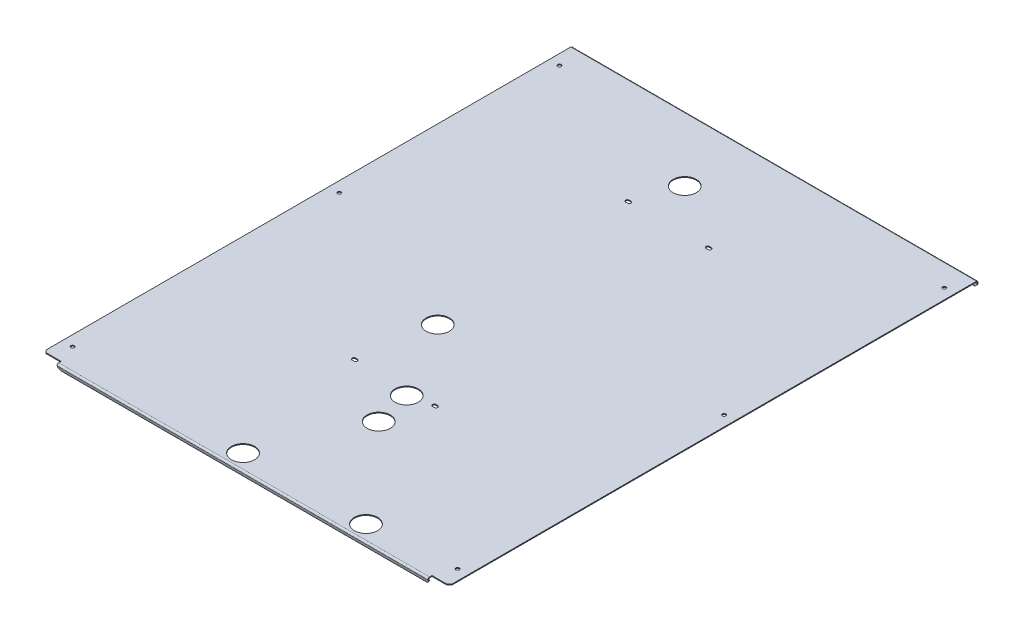
from build123d import *

# Parameters (mm, degrees)
SKETCH2_W               = 444.5
SKETCH2_H               = 584.2
BOSS_EXTRUDE1_DEPTH     = 6.35
MOVE_START              = -2.17182791
MOVE_FACE1_OUTLINE_W    = 448
MOVE_FACE1_OUTLINE_H    = 9
MOVE_FACE1_DEPTH        = 2.17182791
CONVERT_SOLID1_START    = -222.25
CONVERT_SOLID1_DEPTH    = 444.5
SKETCH7_W               = 19.05
SKETCH7_H               = 5.08
CUT_EXTRUDE1_DEPTH      = 626.080014878
SKETCH9_R               = 1.905
CUT_EXTRUDE2_DEPTH      = 1.2192
CHAMFER1_SIZE           = 2.54
CUT_EXTRUDE3_DEPTH      = 626.080014878
CUT_EXTRUDE3_DEPTH_BACK = 626.080014878
SKETCH10_R              = 12.7


# Read off the part's stored shape, not the designer's step: Move Face1, Convert-Solid1
with BuildPart() as part:
    # Sketch2 → Boss-Extrude1 (new body)
    with BuildSketch(Plane(origin=(0, 0, 0), x_dir=(1, 0, 0), z_dir=(0, 1, 0))):
        with Locations((0, 292.1)):
            Rectangle(SKETCH2_W, SKETCH2_H)
    extrude(amount=-BOSS_EXTRUDE1_DEPTH)

    # Move Face1 outline → Move Face1 (cut)
    with BuildSketch(Plane(origin=(0, 0, 0), x_dir=(1, 0, 0), z_dir=(0, 0.3420201433256691, -0.9396926207859083)).offset(MOVE_START)):
        with Locations((0, 3.5)):
            Rectangle(MOVE_FACE1_OUTLINE_W, MOVE_FACE1_OUTLINE_H)
    extrude(amount=MOVE_FACE1_DEPTH, mode=Mode.SUBTRACT)

    # Convert-Solid1 outline → Convert-Solid1 (cut)
    with BuildSketch(Plane.YZ.offset(CONVERT_SOLID1_START)):
        with BuildLine():
            Line((-6.037256781, -3.17046592), (-6.35, -2.311210988))
            Line((-6.35, -2.311210988), (-6.35, -583.2856))
            Line((-6.35, -583.2856), (-1.6764, -583.2856))
            ThreePointArc((-1.6764, -583.2856), (-1.137584633, -583.062415367), (-0.9144, -582.5236))
            Line((-0.9144, -582.5236), (-0.9144, -2.394147319))
            ThreePointArc((-0.9144, -2.394147319), (-1.239334756, -1.769953461), (-1.937019349, -1.678101541))
            Line((-1.937019349, -1.678101541), (-6.037256781, -3.17046592))
        make_face()
        with BuildLine():
            Line((0, 0), (-2.249762568, -0.818846609))
            ThreePointArc((-2.249762568, -0.818846609), (-0.714856462, -1.020920831), (0, -2.394147319))
            Line((0, -2.394147319), (0, 0))
        make_face()
        with BuildLine():
            Line((0, -584.2), (0, -582.5236))
            ThreePointArc((0, -582.5236), (-0.491006192, -583.708993808), (-1.6764, -584.2))
            Line((-1.6764, -584.2), (0, -584.2))
        make_face()
    extrude(amount=CONVERT_SOLID1_DEPTH, mode=Mode.SUBTRACT)

    # Sketch7 → Cut-Extrude1 (cut, through all)
    with BuildSketch(Plane(origin=(0, 0, 0), x_dir=(1, 0, 0), z_dir=(0, 1, 0))):
        with Locations((-212.725, 2.54)):
            Rectangle(SKETCH7_W, SKETCH7_H)
        with Locations((212.725, 2.54)):
            Rectangle(SKETCH7_W, SKETCH7_H)
    extrude(amount=-CUT_EXTRUDE1_DEPTH, mode=Mode.SUBTRACT)

    # Sketch9 → Cut-Extrude2 (cut)
    with BuildSketch(Plane(origin=(0, 0, 0), x_dir=(1, 0, 0), z_dir=(0, 1, 0))):
        with Locations(Location((-210.82, 25.4, 0), (0, 0, 270))):
            Circle(SKETCH9_R)
        with Locations(Location((-210.82, 317.5, 0), (0, 0, 270))):
            Circle(SKETCH9_R)
        with Locations(Location((-210.82, 558.8, 0), (0, 0, 270))):
            Circle(SKETCH9_R)
        with Locations(Location((210.82, 558.8, 0), (0, 0, 90))):
            Circle(SKETCH9_R)
        with Locations(Location((210.82, 317.5, 0), (0, 0, 90))):
            Circle(SKETCH9_R)
        with Locations(Location((210.82, 25.4, 0), (0, 0, 90))):
            Circle(SKETCH9_R)
        with BuildLine():
            Line((-43.0182, 465.455), (-45.0182, 465.455))
            ThreePointArc((-45.0182, 465.455), (-46.9232, 467.36), (-45.0182, 469.265))
            Line((-45.0182, 469.265), (-43.0182, 469.265))
            ThreePointArc((-43.0182, 469.265), (-41.1132, 467.36), (-43.0182, 465.455))
        make_face()
        with BuildLine():
            Line((45.0182, 465.455), (43.0182, 465.455))
            ThreePointArc((43.0182, 465.455), (41.1132, 467.36), (43.0182, 469.265))
            Line((43.0182, 469.265), (45.0182, 469.265))
            ThreePointArc((45.0182, 469.265), (46.9232, 467.36), (45.0182, 465.455))
        make_face()
        with BuildLine():
            Line((-43.0182, 165.735), (-45.0182, 165.735))
            ThreePointArc((-45.0182, 165.735), (-46.9232, 167.64), (-45.0182, 169.545))
            Line((-45.0182, 169.545), (-43.0182, 169.545))
            ThreePointArc((-43.0182, 169.545), (-41.1132, 167.64), (-43.0182, 165.735))
        make_face()
        with BuildLine():
            Line((45.0182, 165.735), (43.0182, 165.735))
            ThreePointArc((43.0182, 165.735), (41.1132, 167.64), (43.0182, 169.545))
            Line((43.0182, 169.545), (45.0182, 169.545))
            ThreePointArc((45.0182, 169.545), (46.9232, 167.64), (45.0182, 165.735))
        make_face()
    extrude(amount=-CUT_EXTRUDE2_DEPTH, mode=Mode.SUBTRACT)

    # Chamfer1
    chamfer1_edges = [part.edges().sort_by_distance(p)[0] for p in [
        (-222.25, -6.35, -583.7428),
        (222.25, -6.35, -583.7428),
        (-222.25, -0.4572, -5.08),
        (-203.2, -6.193628391, -2.740838454),
        (222.25, -0.4572, -5.08),
        (203.2, -6.193628391, -2.740838454),
    ]]
    chamfer(chamfer1_edges, length=CHAMFER1_SIZE)

    # Sketch10 → Cut-Extrude3 (cut, two sides: drawn at the far end of the back side and taken through both)
    with BuildSketch(Plane(origin=(0, 0, 0), x_dir=(1, 0, 0), z_dir=(0, 1, 0)).offset(-CUT_EXTRUDE3_DEPTH_BACK)):
        with Locations(Location((18.542, 162.007747319, 0), (0, 0, 270))):
            Circle(SKETCH10_R)
        with Locations(Location((-16.51, 17.78, 0), (0, 0, 270))):
            Circle(SKETCH10_R)
        with Locations(Location((-31.75, 246.38, 0), (0, 0, 270))):
            Circle(SKETCH10_R)
        with Locations(Location((118.11, 17.78, 0), (0, 0, 270))):
            Circle(SKETCH10_R)
        with Locations(Location((-27.94, 513.08, 0), (0, 0, 270))):
            Circle(SKETCH10_R)
        with Locations(Location((27.94, 121.92, 0), (0, 0, 270))):
            Circle(SKETCH10_R)
    extrude(amount=CUT_EXTRUDE3_DEPTH + CUT_EXTRUDE3_DEPTH_BACK, mode=Mode.SUBTRACT)


solid = part.part
